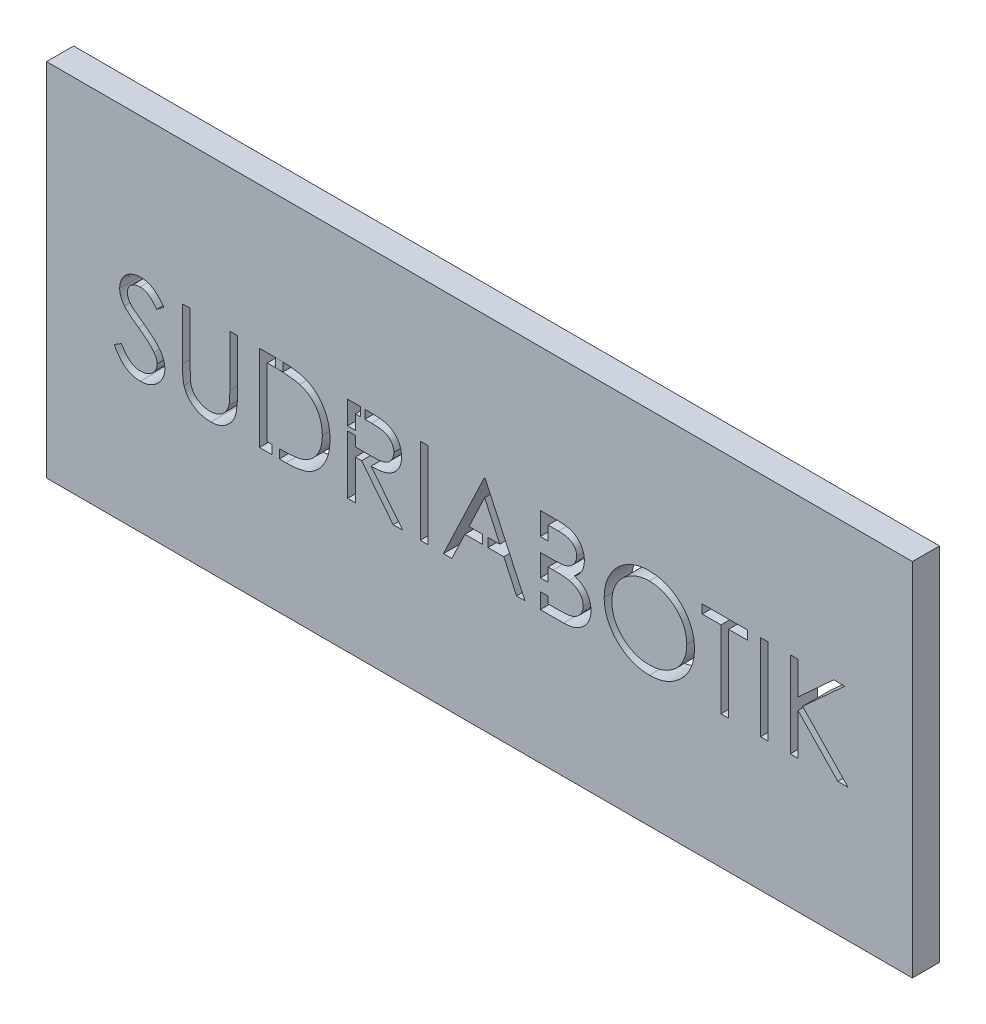
from build123d import *

# Parameters (mm, degrees)
ESQUISSE1_W             = 330
ESQUISSE1_H             = 238
ESQUISSE1_R             = 8
ESQUISSE1_W_2           = 15
ESQUISSE1_H_2           = 6
ESQUISSE1_W_3           = 20
BOSS_EXTRU_1_DEPTH      = 6
ESQUISSE2_W             = 20
ESQUISSE2_H             = 6
BOSS_EXTRU_2_DEPTH      = 6
ESQUISSE3_W             = 6
ESQUISSE3_H             = 20
ESQUISSE3_W_2           = 12
ESQUISSE3_H_2           = 10
ENL_V_MAT_EXTRU_1_DEPTH = 6
ESQUISSE4_R             = 1.5
ENL_V_MAT_EXTRU_2_DEPTH = 6
ESQUISSE5_W             = 423.604058921
ESQUISSE5_H             = 150.356061945
ENL_V_MAT_EXTRU_3_DEPTH = 6
ESQUISSE6_W             = 1.709615384
ESQUISSE6_H             = 19.05
ESQUISSE6_W_2           = 1.709615385
ENL_V_MAT_EXTRU_4_DEPTH = 6
ESQUISSE7_W             = 1.58262541
ESQUISSE7_H             = 1.953846154
ESQUISSE7_W_2           = 1.587980571
ESQUISSE7_H_2           = 1.936817114
ESQUISSE7_W_3           = 0.906225897
ESQUISSE7_W_4           = 1.709615385
ESQUISSE7_H_3           = 0.97063598
ESQUISSE7_W_5           = 1.216684544
ESQUISSE7_W_6           = 1.709615384
ESQUISSE7_H_4           = 3.052884616
ESQUISSE7_H_5           = 2.641773465
BOSS_EXTRU_5_DEPTH      = 6
ENL_V_MAT_EXTRU_5_DEPTH = 6


with BuildPart() as part:
    # Esquisse1 → Boss.-Extru.1 (new body)
    with BuildSketch(Plane.XY):
        Rectangle(ESQUISSE1_W, ESQUISSE1_H)
        with Locations((-125, 76)):
            Circle(ESQUISSE1_R, mode=Mode.SUBTRACT)
        with Locations((125, 76)):
            Circle(ESQUISSE1_R, mode=Mode.SUBTRACT)
        with Locations((-85, -58)):
            Rectangle(ESQUISSE1_W_2, ESQUISSE1_H_2, mode=Mode.SUBTRACT)
        with Locations((0, -58)):
            Rectangle(ESQUISSE1_W_2, ESQUISSE1_H_2, mode=Mode.SUBTRACT)
        with Locations((85, -58)):
            Rectangle(ESQUISSE1_W_2, ESQUISSE1_H_2, mode=Mode.SUBTRACT)
        with Locations((65, 96)):
            Rectangle(ESQUISSE1_W_3, ESQUISSE1_H_2, mode=Mode.SUBTRACT)
        with Locations((95, 96)):
            Rectangle(ESQUISSE1_W_3, ESQUISSE1_H_2, mode=Mode.SUBTRACT)
    extrude(amount=BOSS_EXTRU_1_DEPTH)

    # Esquisse2 → Boss.-Extru.2 (add)
    with BuildSketch(Plane.XY.offset(6)):
        with Locations((-105, 122)):
            Rectangle(ESQUISSE2_W, ESQUISSE2_H)
        with Locations((105, 122)):
            Rectangle(ESQUISSE2_W, ESQUISSE2_H)
        with Locations((35, 122)):
            Rectangle(ESQUISSE2_W, ESQUISSE2_H)
        with Locations((-35, 122)):
            Rectangle(ESQUISSE2_W, ESQUISSE2_H)
        with Locations((105, -122)):
            Rectangle(ESQUISSE2_W, ESQUISSE2_H)
        with Locations((-105, -122)):
            Rectangle(ESQUISSE2_W, ESQUISSE2_H)
        with Locations((-35, -122)):
            Rectangle(ESQUISSE2_W, ESQUISSE2_H)
        with Locations((35, -122)):
            Rectangle(ESQUISSE2_W, ESQUISSE2_H)
    extrude(amount=-BOSS_EXTRU_2_DEPTH)

    # Esquisse3 → Enlèv. mat.-Extru.1 (cut)
    with BuildSketch(Plane.XY.offset(6)):
        with Locations((-162, 79)):
            Rectangle(ESQUISSE3_W, ESQUISSE3_H)
        with Locations((-162, 19)):
            Rectangle(ESQUISSE3_W, ESQUISSE3_H)
        with Locations((-162, -19)):
            Rectangle(ESQUISSE3_W, ESQUISSE3_H)
        with Locations((-162, -79)):
            Rectangle(ESQUISSE3_W, ESQUISSE3_H)
        with Locations((162, -79)):
            Rectangle(ESQUISSE3_W, ESQUISSE3_H)
        with Locations((162, -19)):
            Rectangle(ESQUISSE3_W, ESQUISSE3_H)
        with Locations((162, 19)):
            Rectangle(ESQUISSE3_W, ESQUISSE3_H)
        with Locations((162, 79)):
            Rectangle(ESQUISSE3_W, ESQUISSE3_H)
        with Locations((159, -114)):
            Rectangle(ESQUISSE3_W_2, ESQUISSE3_H_2)
        with Locations((-159, -114)):
            Rectangle(ESQUISSE3_W_2, ESQUISSE3_H_2)
    extrude(amount=-ENL_V_MAT_EXTRU_1_DEPTH, mode=Mode.SUBTRACT)

    # Esquisse4 → Enlèv. mat.-Extru.2 (cut)
    with BuildSketch(Plane.XY.offset(6)):
        with Locations((-162, 114)):
            Circle(ESQUISSE4_R)
        with Locations((-162, 94)):
            Circle(ESQUISSE4_R)
        with Locations((-162, 64)):
            Circle(ESQUISSE4_R)
        with Locations((-162, 34)):
            Circle(ESQUISSE4_R)
        with Locations((-162, 4)):
            Circle(ESQUISSE4_R)
        with Locations((-105, 122)):
            Circle(ESQUISSE4_R)
        with Locations((-162, -4)):
            Circle(ESQUISSE4_R)
        with Locations((-162, -34)):
            Circle(ESQUISSE4_R)
        with Locations((-162, -64)):
            Circle(ESQUISSE4_R)
        with Locations((-162, -94)):
            Circle(ESQUISSE4_R)
        with Locations((-97.5, -58)):
            Circle(ESQUISSE4_R)
        with Locations((-72.5, -58)):
            Circle(ESQUISSE4_R)
        with Locations((162, -94)):
            Circle(ESQUISSE4_R)
        with Locations((162, -64)):
            Circle(ESQUISSE4_R)
        with Locations((162, -34)):
            Circle(ESQUISSE4_R)
        with Locations((162, -4)):
            Circle(ESQUISSE4_R)
        with Locations((80, 96)):
            Circle(ESQUISSE4_R)
        with Locations((162, 4)):
            Circle(ESQUISSE4_R)
        with Locations((162, 34)):
            Circle(ESQUISSE4_R)
        with Locations((162, 64)):
            Circle(ESQUISSE4_R)
        with Locations((162, 94)):
            Circle(ESQUISSE4_R)
        with Locations((162, 114)):
            Circle(ESQUISSE4_R)
        with Locations((-12.5, -58)):
            Circle(ESQUISSE4_R)
        with Locations((12.5, -58)):
            Circle(ESQUISSE4_R)
        with Locations((72.5, -58)):
            Circle(ESQUISSE4_R)
        with Locations((97.5, -58)):
            Circle(ESQUISSE4_R)
        with Locations((-35, 122)):
            Circle(ESQUISSE4_R)
        with Locations((35, 122)):
            Circle(ESQUISSE4_R)
        with Locations((105, 122)):
            Circle(ESQUISSE4_R)
    extrude(amount=-ENL_V_MAT_EXTRU_2_DEPTH, mode=Mode.SUBTRACT)

    # Esquisse5 → Enlèv. mat.-Extru.3 (cut)
    with BuildSketch(Plane.XY.offset(6)):
        with Locations((11.705214191, -75.178030973)):
            Rectangle(ESQUISSE5_W, ESQUISSE5_H)
    extrude(amount=-ENL_V_MAT_EXTRU_3_DEPTH, mode=Mode.SUBTRACT)

    # Esquisse6 → Enlèv. mat.-Extru.4 (cut)
    # profile 1 of 11: a face of its own
    with BuildSketch(Plane.XY.offset(6)):
        with BuildLine():
            Line((-81.011538462, 33.174909856), (-79.401141827, 34.140384615))
            add(Edge.make_bspline(
                [(-79.401141827, 34.140384615), (-79.251363993, 33.889662749), (-78.964395442, 33.409289328), (-78.485688759, 32.760184851), (-77.989665343, 32.208485112), (-77.47265197, 31.757399576), (-76.937804452, 31.402259207), (-76.381631246, 31.15078706), (-75.80600659, 30.993945823), (-75.414263362, 30.974895352), (-75.218689904, 30.965384615)],
                knots=[0, 0, 0, 0, 1.272034388, 2.437168799, 3.508375237, 4.49857839, 5.41946034, 6.295179144, 7.148887113, 8, 8, 8, 8], degree=3))
            add(Edge.make_bspline(
                [(-75.218689904, 30.965384615), (-75.051665706, 30.970036476), (-74.720539841, 30.9792588), (-74.233065347, 31.06787288), (-73.759635824, 31.204010324), (-73.31000881, 31.398978537), (-72.890388393, 31.634863724), (-72.522414809, 31.91977649), (-72.204300964, 32.238761695), (-71.944082784, 32.594630144), (-71.744438591, 32.977356339), (-71.59099319, 33.370199731), (-71.50583929, 33.77933151), (-71.493011817, 34.054797029), (-71.486538462, 34.193810096)],
                knots=[0, 0, 0, 0, 1.095163259, 2.171163733, 3.241058638, 4.321873601, 5.38011039, 6.391990106, 7.366004449, 8.327778327, 9.272591725, 10.192022065, 11.087607919, 12, 12, 12, 12], degree=3))
            add(Edge.make_bspline(
                [(-71.486538462, 34.193810096), (-71.494562924, 34.352419578), (-71.510875484, 34.674849478), (-71.648751111, 35.150553303), (-71.865644869, 35.621320006), (-72.065738687, 35.912519751), (-72.169621394, 36.063701923)],
                knots=[0, 0, 0, 0, 0.938893495, 1.908633276, 2.914225137, 4, 4, 4, 4], degree=3))
            add(Edge.make_bspline(
                [(-72.169621394, 36.063701923), (-72.254914309, 36.17281392), (-72.433976113, 36.401880909), (-72.741810575, 36.742849977), (-73.103031854, 37.0945588), (-73.505278346, 37.470437381), (-73.963202729, 37.853003818), (-74.462462486, 38.260501159), (-75.015804347, 38.6774326), (-75.403877322, 38.957046135), (-75.604116587, 39.101322115)],
                knots=[0, 0, 0, 0, 0.722233717, 1.516239348, 2.393582979, 3.351407094, 4.387010283, 5.505090956, 6.712668013, 8, 8, 8, 8], degree=3))
            add(Edge.make_bspline(
                [(-75.604116587, 39.101322115), (-75.804544337, 39.244080571), (-76.187746934, 39.517023867), (-76.723642932, 39.922104613), (-77.202856367, 40.292457674), (-77.623257299, 40.631569511), (-77.984660819, 40.939486117), (-78.289914814, 41.213250614), (-78.531243246, 41.460266853), (-78.665440049, 41.62051187), (-78.725691106, 41.692457933)],
                knots=[0, 0, 0, 0, 1.452282411, 2.77665338, 3.964542531, 5.026858415, 5.96415736, 6.766646006, 7.446254459, 8, 8, 8, 8], degree=3))
            add(Edge.make_bspline(
                [(-78.725691106, 41.692457933), (-78.809905959, 41.804586433), (-78.97552577, 42.025102178), (-79.1941436, 42.369770333), (-79.379958186, 42.722594106), (-79.525621737, 43.084521597), (-79.648283157, 43.45047171), (-79.730785608, 43.825219204), (-79.782445925, 44.207082542), (-79.787736309, 44.464058881), (-79.790384615, 44.592698317)],
                knots=[0, 0, 0, 0, 1.068054152, 2.10047183, 3.106115577, 4.101338837, 5.06977816, 6.043150881, 7.020423561, 8, 8, 8, 8], degree=3))
            add(Edge.make_bspline(
                [(-79.790384615, 44.592698317), (-79.783280549, 44.79424609), (-79.769224262, 45.193033694), (-79.650349446, 45.775587214), (-79.462718411, 46.331773285), (-79.199856235, 46.85608553), (-78.860998357, 47.334871798), (-78.468862411, 47.773639491), (-78.00180275, 48.142494203), (-77.489343472, 48.464776978), (-76.928422361, 48.717031228), (-76.340643301, 48.907318848), (-75.725072095, 49.015137808), (-75.308132177, 49.030610571), (-75.096574519, 49.038461538)],
                knots=[0, 0, 0, 0, 1.005424448, 1.989358655, 2.955360095, 3.929531133, 4.905563448, 5.876582895, 6.856512386, 7.866279853, 8.892233794, 9.918561126, 10.94386622, 12, 12, 12, 12], degree=3))
            add(Edge.make_bspline(
                [(-75.096574519, 49.038461538), (-74.872088773, 49.030718793), (-74.425658273, 49.015320944), (-73.768981828, 48.881440095), (-73.136735643, 48.659912153), (-72.628137302, 48.408513886), (-72.230086129, 48.157427181), (-71.926523112, 47.92871928), (-71.618906702, 47.665420475), (-71.304755575, 47.366829435), (-70.989392843, 47.030206404), (-70.668136624, 46.657856798), (-70.340235675, 46.252056115), (-70.129293065, 45.962362761), (-70.021153846, 45.813852163)],
                knots=[0, 0, 0, 0, 1.286793592, 2.559021753, 3.825965368, 5.121522368, 5.803751409, 6.523245864, 7.299691795, 8.125521123, 9.008227632, 9.944561021, 10.946284179, 12, 12, 12, 12], degree=3))
            Line((-70.021153846, 45.813852163), (-71.566676683, 44.642307692))
            add(Edge.make_bspline(
                [(-71.566676683, 44.642307692), (-71.659999544, 44.762533279), (-71.839717554, 44.994059648), (-72.11256519, 45.318297809), (-72.369732831, 45.614478933), (-72.623100007, 45.871736273), (-72.859285344, 46.104157885), (-73.088522388, 46.303147418), (-73.307512214, 46.470654588), (-73.583557113, 46.649417392), (-73.930363552, 46.82661779), (-74.365707956, 46.976563487), (-74.82065611, 47.066670324), (-75.130515962, 47.078584126), (-75.287379808, 47.084615385)],
                knots=[0, 0, 0, 0, 1.181633172, 2.275549214, 3.290209073, 4.226197932, 5.078386478, 5.862611352, 6.581680152, 7.217281963, 8.414376989, 9.595101626, 10.782541182, 12, 12, 12, 12], degree=3))
            add(Edge.make_bspline(
                [(-75.287379808, 47.084615385), (-75.484174594, 47.078020275), (-75.863674801, 47.065302227), (-76.402464514, 46.926400593), (-76.887390021, 46.707696467), (-77.304054696, 46.401182087), (-77.650965957, 46.038029255), (-77.901911383, 45.620132915), (-78.052951564, 45.15867441), (-78.0713826, 44.836774823), (-78.080769231, 44.672836538)],
                knots=[0, 0, 0, 0, 1.14458467, 2.207223713, 3.21896685, 4.227309161, 5.202851033, 6.127160689, 7.046193047, 8, 8, 8, 8], degree=3))
            add(Edge.make_bspline(
                [(-78.080769231, 44.672836538), (-78.078629499, 44.57077492), (-78.074346536, 44.366484791), (-78.01461228, 44.064670623), (-77.937871646, 43.763618904), (-77.816263893, 43.464683132), (-77.648377312, 43.162635263), (-77.427913426, 42.852274092), (-77.150255256, 42.530864077), (-76.937564661, 42.321818229), (-76.825270433, 42.211448317)],
                knots=[0, 0, 0, 0, 0.858281714, 1.717966888, 2.583508476, 3.4729293, 4.427298488, 5.488583878, 6.674047936, 8, 8, 8, 8], degree=3))
            add(Edge.make_bspline(
                [(-76.825270433, 42.211448317), (-76.783570677, 42.174235363), (-76.684501603, 42.0858259), (-76.503385493, 41.941087915), (-76.26421112, 41.762547112), (-75.973223996, 41.541636147), (-75.625058785, 41.285378474), (-75.2196772, 40.997050671), (-74.761598, 40.667292672), (-74.436540144, 40.43674663), (-74.264663462, 40.31484375)],
                knots=[0, 0, 0, 0, 0.420754252, 0.999615792, 1.744751191, 2.668019286, 3.750313428, 4.999500688, 6.413464383, 8, 8, 8, 8], degree=3))
            add(Edge.make_bspline(
                [(-74.264663462, 40.31484375), (-74.057911562, 40.164395779), (-73.657565164, 39.873074134), (-73.087928907, 39.435383076), (-72.571435466, 39.007314507), (-72.106271458, 38.591602102), (-71.687841428, 38.191399196), (-71.320787548, 37.801891029), (-71.001369774, 37.425868126), (-70.657494313, 36.94378025), (-70.306115324, 36.351700348), (-70.004355119, 35.626285936), (-69.814081828, 34.898051677), (-69.789199723, 34.408592753), (-69.776923077, 34.167097356)],
                knots=[0, 0, 0, 0, 1.163667725, 2.253281268, 3.268753668, 4.215851969, 5.092017293, 5.902905408, 6.650798638, 7.335211899, 8.59617414, 9.77448103, 10.901945474, 12, 12, 12, 12], degree=3))
            add(Edge.make_bspline(
                [(-69.776923077, 34.167097356), (-69.780499786, 33.996309397), (-69.787583746, 33.658050067), (-69.869013863, 33.16136172), (-69.988319469, 32.678956558), (-70.168136414, 32.216797503), (-70.387609604, 31.76642958), (-70.666100181, 31.339666579), (-70.988903437, 30.927063181), (-71.3592015, 30.539621607), (-71.764399911, 30.183951597), (-72.192664021, 29.86756342), (-72.644694792, 29.60375726), (-73.11804003, 29.388487677), (-73.612808463, 29.22012096), (-74.128833686, 29.098130915), (-74.666966312, 29.023260545), (-75.032728933, 29.015489444), (-75.218689904, 29.011538462)],
                knots=[0, 0, 0, 0, 0.983748083, 1.948392443, 2.894712957, 3.844097841, 4.80183111, 5.778335162, 6.776009319, 7.81870978, 8.863265674, 9.881300176, 10.883814829, 11.87499822, 12.874611388, 13.892143829, 14.928324115, 16, 16, 16, 16], degree=3))
            add(Edge.make_bspline(
                [(-75.218689904, 29.011538462), (-75.362573699, 29.01432075), (-75.648529222, 29.019850287), (-76.07149083, 29.068734113), (-76.485907737, 29.137897063), (-76.886579758, 29.247701643), (-77.278669098, 29.380926333), (-77.660470475, 29.544964972), (-78.032168925, 29.741545739), (-78.395847483, 29.966308659), (-78.750581205, 30.227880098), (-79.093042881, 30.532535842), (-79.434468876, 30.87187352), (-79.764781705, 31.255108157), (-80.090662676, 31.676048294), (-80.40568659, 32.138632278), (-80.716374225, 32.640340446), (-80.9113127, 32.993391841), (-81.011538462, 33.174909856)],
                knots=[0, 0, 0, 0, 0.915332311, 1.819136955, 2.706846663, 3.586547465, 4.459518054, 5.340707479, 6.227863349, 7.133153174, 8.059268498, 9.028702269, 10.047606654, 11.120612155, 12.245963614, 13.433783089, 14.680604001, 16, 16, 16, 16], degree=3))
        make_face()
    # profile 2 of 11: a face of its own
    with BuildSketch(Plane.XY.offset(6)):
        with BuildLine():
            Line((-65.869230769, 48.55), (-64.159615385, 48.55))
            Line((-64.159615385, 48.55), (-64.159615385, 37.136027644))
            add(Edge.make_bspline(
                [(-64.159615385, 37.136027644), (-64.159869805, 36.97447964), (-64.160352613, 36.667914462), (-64.157127644, 36.231569854), (-64.148095939, 35.843644041), (-64.142401842, 35.502641707), (-64.129734498, 35.21012761), (-64.1194037, 34.96451699), (-64.106120098, 34.766972831), (-64.090155559, 34.651688077), (-64.083293269, 34.602133413)],
                knots=[0, 0, 0, 0, 1.528628734, 2.90083645, 4.128790002, 5.200304208, 6.127813768, 6.898992206, 7.526736466, 8, 8, 8, 8], degree=3))
            add(Edge.make_bspline(
                [(-64.083293269, 34.602133413), (-64.055113101, 34.423353173), (-64.000340615, 34.075866319), (-63.860751044, 33.581065527), (-63.665801503, 33.135124305), (-63.434790085, 32.724127134), (-63.130356872, 32.359513618), (-62.765666201, 32.023625907), (-62.323827204, 31.729865085), (-61.832551622, 31.461255666), (-61.303041972, 31.245364289), (-60.761960651, 31.082114692), (-60.217441007, 30.982625252), (-59.852899308, 30.971105233), (-59.671875, 30.965384615)],
                knots=[0, 0, 0, 0, 1.035780045, 2.013197591, 2.933192213, 3.817615948, 4.702609284, 5.640816605, 6.646850145, 7.73207398, 8.84249596, 9.914020372, 10.964143139, 12, 12, 12, 12], degree=3))
            add(Edge.make_bspline(
                [(-59.671875, 30.965384615), (-59.51646107, 30.971229429), (-59.20653084, 30.982885298), (-58.746030125, 31.055065373), (-58.297538105, 31.185152738), (-57.858840118, 31.353009137), (-57.447626903, 31.574792454), (-57.063669026, 31.830992309), (-56.720965327, 32.13149722), (-56.408229653, 32.464057667), (-56.135896645, 32.839287149), (-55.899833717, 33.249015301), (-55.706471157, 33.699408174), (-55.610984258, 34.015934387), (-55.561929087, 34.178545673)],
                knots=[0, 0, 0, 0, 0.994687771, 1.983630487, 2.973142513, 3.978332533, 4.983357753, 5.956394766, 6.925816176, 7.893390482, 8.871859704, 9.88551698, 10.913711441, 12, 12, 12, 12], degree=3))
            add(Edge.make_bspline(
                [(-55.561929087, 34.178545673), (-55.545599833, 34.245757199), (-55.509211676, 34.395531565), (-55.475209903, 34.648740304), (-55.439795814, 34.947495271), (-55.415223655, 35.293942995), (-55.391268441, 35.686922574), (-55.376937002, 36.128481204), (-55.370312865, 36.617015519), (-55.368338848, 36.957940643), (-55.367307692, 37.136027644)],
                knots=[0, 0, 0, 0, 0.558680831, 1.244966039, 2.062412453, 2.990489873, 4.051219941, 5.244515665, 6.560634259, 8, 8, 8, 8], degree=3))
            Line((-55.367307692, 37.136027644), (-55.367307692, 48.55))
            Line((-55.367307692, 48.55), (-53.657692308, 48.55))
            Line((-53.657692308, 48.55), (-53.657692308, 37.044441106))
            add(Edge.make_bspline(
                [(-53.657692308, 37.044441106), (-53.659075449, 36.837077072), (-53.661774732, 36.432393552), (-53.685182156, 35.839386869), (-53.722503826, 35.276851356), (-53.775234705, 34.744711397), (-53.84510468, 34.244871187), (-53.922802666, 33.77294952), (-54.021751267, 33.332333946), (-54.137321636, 32.91958893), (-54.269439091, 32.526693493), (-54.440568769, 32.15381089), (-54.633379262, 31.789605372), (-54.862059016, 31.439585522), (-55.119023827, 31.102201569), (-55.409953689, 30.779499603), (-55.725226622, 30.466322794), (-56.070083654, 30.170704534), (-56.438840084, 29.899603022), (-56.830398996, 29.66121801), (-57.241752557, 29.45970375), (-57.671831487, 29.293827647), (-58.12081932, 29.169106757), (-58.588727377, 29.076169123), (-59.076620701, 29.023360904), (-59.408442616, 29.015512684), (-59.576472356, 29.011538462)],
                knots=[0, 0, 0, 0, 1.316592851, 2.569410997, 3.76748051, 4.895814652, 5.963796859, 6.97159953, 7.931736103, 8.829262218, 9.692595152, 10.560224239, 11.431080259, 12.30701507, 13.211635791, 14.121146779, 15.063487852, 16.031507147, 17.00238618, 17.966455255, 18.938106653, 19.907068911, 20.888905087, 21.893141452, 22.933117798, 24, 24, 24, 24], degree=3))
            add(Edge.make_bspline(
                [(-59.576472356, 29.011538462), (-59.759728471, 29.015809827), (-60.119276315, 29.02419023), (-60.649073509, 29.072211199), (-61.156969349, 29.162662745), (-61.648328051, 29.277833296), (-62.116460014, 29.436676209), (-62.56763719, 29.622267431), (-62.994132297, 29.850199376), (-63.402864355, 30.103800558), (-63.782910527, 30.389140375), (-64.131783536, 30.700146179), (-64.450059346, 31.031835947), (-64.73237325, 31.387800795), (-64.983402636, 31.765272229), (-65.199648512, 32.165318091), (-65.385322026, 32.587783498), (-65.481152056, 32.88144306), (-65.529597356, 33.029897837)],
                knots=[0, 0, 0, 0, 1.13879206, 2.234305948, 3.301075583, 4.341971843, 5.366689343, 6.369221514, 7.369726634, 8.367512178, 9.355451585, 10.318319045, 11.268648973, 12.207971039, 13.137398894, 14.081662264, 15.030215811, 16, 16, 16, 16], degree=3))
            add(Edge.make_bspline(
                [(-65.529597356, 33.029897837), (-65.557775888, 33.131312277), (-65.618895752, 33.351282458), (-65.68434773, 33.71533606), (-65.739370017, 34.134517255), (-65.791107412, 34.608854735), (-65.821636169, 35.138716152), (-65.848401085, 35.723871822), (-65.869419325, 36.3650293), (-65.869295378, 36.811640306), (-65.869230769, 37.044441106)],
                knots=[0, 0, 0, 0, 0.625038921, 1.35572334, 2.194682327, 3.136881307, 4.189498639, 5.346923369, 6.617055217, 8, 8, 8, 8], degree=3))
            Line((-65.869230769, 37.044441106), (-65.869230769, 48.55))
        make_face()
    # profile 3 of 11: a face of its own
    with BuildSketch(Plane.XY.offset(6)):
        with BuildLine():
            Line((-48.773076923, 29.5), (-48.773076923, 48.55))
            Line((-48.773076923, 48.55), (-44.926442308, 48.55))
            add(Edge.make_bspline(
                [(-44.926442308, 48.55), (-44.591875386, 48.547591155), (-43.945493835, 48.542937278), (-43.0114318, 48.513429421), (-42.147194464, 48.461229885), (-41.355624188, 48.38519575), (-40.634547877, 48.291834239), (-39.985984596, 48.174810609), (-39.406580789, 48.036626425), (-39.050239977, 47.918813331), (-38.881730769, 47.863100962)],
                knots=[0, 0, 0, 0, 1.314313732, 2.53924729, 3.670748893, 4.714932338, 5.66265055, 6.526160246, 7.303039223, 8, 8, 8, 8], degree=3))
            add(Edge.make_bspline(
                [(-38.881730769, 47.863100962), (-38.661323688, 47.779113835), (-38.225507627, 47.613044132), (-37.604983146, 47.299773406), (-37.020826527, 46.944827809), (-36.469905182, 46.547739471), (-35.964803541, 46.097264945), (-35.485789132, 45.612539951), (-35.052457563, 45.075937699), (-34.655628124, 44.498586693), (-34.29783832, 43.887288237), (-33.986838047, 43.243207146), (-33.72855274, 42.569614342), (-33.514141035, 41.868383036), (-33.345159602, 41.137971323), (-33.229869374, 40.377528709), (-33.153827272, 39.59006055), (-33.146185221, 39.055710968), (-33.142307692, 38.784585337)],
                knots=[0, 0, 0, 0, 0.984719456, 1.947108742, 2.898477687, 3.838006223, 4.779231079, 5.722358779, 6.681677486, 7.655904652, 8.64651281, 9.637519902, 10.640069247, 11.656948941, 12.698408672, 13.768548281, 14.867775369, 16, 16, 16, 16], degree=3))
            add(Edge.make_bspline(
                [(-33.142307692, 38.784585337), (-33.145731072, 38.549120596), (-33.152477201, 38.08511273), (-33.213052477, 37.401267284), (-33.301097876, 36.737709131), (-33.437409867, 36.097598107), (-33.602886405, 35.47532595), (-33.814962714, 34.877524734), (-34.057907343, 34.298710572), (-34.341207396, 33.746709738), (-34.652219792, 33.223741669), (-34.98598528, 32.730752009), (-35.342147865, 32.274775444), (-35.72410381, 31.854431142), (-36.126917238, 31.470352779), (-36.55322538, 31.119331953), (-37.00412827, 30.80823699), (-37.477606347, 30.524843158), (-37.987472136, 30.277626652), (-38.543383065, 30.068457598), (-39.147709905, 29.895121021), (-39.798969299, 29.750499431), (-40.498286514, 29.635778683), (-41.246347171, 29.558890747), (-42.042001933, 29.506895499), (-42.588351934, 29.50234313), (-42.869561298, 29.5)],
                knots=[0, 0, 0, 0, 1.105936401, 2.179363191, 3.223086493, 4.248585256, 5.251745608, 6.245858792, 7.225916811, 8.198733463, 9.158002045, 10.082870192, 10.993790845, 11.873723703, 12.748670949, 13.606408763, 14.465103618, 15.319838547, 16.196477973, 17.123216899, 18.106603292, 19.147568657, 20.255746949, 21.433717677, 22.679120308, 24, 24, 24, 24], degree=3))
            Line((-42.869561298, 29.5), (-48.773076923, 29.5))
        make_face()
        with BuildLine():
            Line((-47.063461538, 31.453846154), (-44.876832933, 31.453846154))
            add(Edge.make_bspline(
                [(-44.876832933, 31.453846154), (-44.562625658, 31.455196507), (-43.958289998, 31.457793731), (-43.089294327, 31.480584079), (-42.295293612, 31.517823767), (-41.576175111, 31.569939548), (-40.93234485, 31.638893011), (-40.362457297, 31.715772839), (-39.868380534, 31.811553249), (-39.569407455, 31.898372042), (-39.43125, 31.938491587)],
                knots=[0, 0, 0, 0, 1.375205317, 2.645023457, 3.804390687, 4.853969522, 5.800190428, 6.637939096, 7.370582563, 8, 8, 8, 8], degree=3))
            add(Edge.make_bspline(
                [(-39.43125, 31.938491587), (-39.257359629, 31.999732211), (-38.913732256, 32.120750728), (-38.419079492, 32.341500284), (-37.957759224, 32.602986406), (-37.5217318, 32.893647355), (-37.117182433, 33.22373488), (-36.739316886, 33.586071262), (-36.388895938, 33.982500538), (-36.069540062, 34.412530674), (-35.783744864, 34.873485133), (-35.536251458, 35.360832214), (-35.319345265, 35.869232138), (-35.149100354, 36.406491987), (-35.015665531, 36.967808719), (-34.921152016, 37.553221823), (-34.862289015, 38.162621971), (-34.855423134, 38.577107105), (-34.851923077, 38.788401442)],
                knots=[0, 0, 0, 0, 0.998632004, 1.973411704, 2.929992603, 3.868527914, 4.809262121, 5.754881198, 6.702106254, 7.672490631, 8.653608572, 9.636854334, 10.631411391, 11.644891563, 12.686317036, 13.754757253, 14.855430412, 16, 16, 16, 16], degree=3))
            add(Edge.make_bspline(
                [(-34.851923077, 38.788401442), (-34.854716827, 39.011196528), (-34.860205173, 39.448879446), (-34.929189634, 40.091085944), (-35.029999815, 40.708744914), (-35.175779591, 41.301897663), (-35.361549089, 41.871701408), (-35.593385639, 42.415004742), (-35.858271096, 42.937545529), (-36.173430686, 43.427263148), (-36.518592701, 43.890412785), (-36.901649445, 44.314710254), (-37.316515112, 44.701122088), (-37.758664792, 45.055666061), (-38.240559575, 45.364078354), (-38.750847521, 45.639958718), (-39.297014674, 45.87408807), (-39.676995204, 45.998614451), (-39.870102163, 46.061899038)],
                knots=[0, 0, 0, 0, 1.122418816, 2.205001699, 3.251619955, 4.274784885, 5.280384055, 6.268708349, 7.249350384, 8.229342522, 9.199999885, 10.157847722, 11.105861043, 12.055065948, 13.010012805, 13.98527497, 14.976112212, 16, 16, 16, 16], degree=3))
            add(Edge.make_bspline(
                [(-39.870102163, 46.061899038), (-40.02985626, 46.106075596), (-40.369537302, 46.200007078), (-40.923834956, 46.302470891), (-41.54766884, 46.392846807), (-42.243808642, 46.469362707), (-43.011460827, 46.524266556), (-43.851215786, 46.56547614), (-44.763436491, 46.593270811), (-45.395801425, 46.595168774), (-45.724008413, 46.596153846)],
                knots=[0, 0, 0, 0, 0.674548936, 1.434276114, 2.292660221, 3.240891867, 4.284742987, 5.42552168, 6.663806718, 8, 8, 8, 8], degree=3))
            Line((-45.724008413, 46.596153846), (-47.063461538, 46.596153846))
            Line((-47.063461538, 46.596153846), (-47.063461538, 31.453846154))
        make_face(mode=Mode.SUBTRACT)
    # profile 4 of 11: a face of its own
    with BuildSketch(Plane.XY.offset(6)):
        with BuildLine():
            Line((-29.234615385, 48.55), (-25.422325721, 48.55))
            add(Edge.make_bspline(
                [(-25.422325721, 48.55), (-25.167920436, 48.549153168), (-24.679434107, 48.547527156), (-23.979628164, 48.538460646), (-23.343754965, 48.51247451), (-22.772146982, 48.490112077), (-22.264814703, 48.449334511), (-21.820202449, 48.410360132), (-21.440357981, 48.359340635), (-21.210419848, 48.311958262), (-21.106310096, 48.290504808)],
                knots=[0, 0, 0, 0, 1.410062039, 2.707475311, 3.878576406, 4.937260626, 5.877586885, 6.699081471, 7.410979367, 8, 8, 8, 8], degree=3))
            add(Edge.make_bspline(
                [(-21.106310096, 48.290504808), (-20.966936899, 48.256069128), (-20.691163714, 48.187932374), (-20.294106925, 48.043916547), (-19.915750391, 47.877258304), (-19.557665776, 47.681512912), (-19.221646684, 47.455227326), (-18.904228449, 47.202307973), (-18.603970713, 46.924138753), (-18.333016411, 46.613706259), (-18.077533858, 46.288024685), (-17.86205862, 45.93585138), (-17.676313066, 45.567579351), (-17.528427824, 45.179463263), (-17.409349139, 44.775267048), (-17.325386322, 44.351329454), (-17.27503343, 43.909581861), (-17.269907044, 43.608276672), (-17.267307692, 43.455498798)],
                knots=[0, 0, 0, 0, 1.027469482, 2.033020251, 3.019912614, 3.986113645, 4.951240523, 5.91722682, 6.890402269, 7.87763091, 8.8651537, 9.85103654, 10.82876324, 11.815024772, 12.821070561, 13.842952187, 14.906261191, 16, 16, 16, 16], degree=3))
            add(Edge.make_bspline(
                [(-17.267307692, 43.455498798), (-17.275303239, 43.201670586), (-17.290904622, 42.706386001), (-17.436365543, 41.987597489), (-17.674634887, 41.317095648), (-18.002965931, 40.695724719), (-18.421083363, 40.135596777), (-18.923594012, 39.643614442), (-19.510778211, 39.231917204), (-20.057400631, 38.946424081), (-20.540259347, 38.763582678), (-20.937769235, 38.634933354), (-21.371385212, 38.535536085), (-21.836952705, 38.446490225), (-22.336409173, 38.379261717), (-22.86855753, 38.330022396), (-23.433777298, 38.299248217), (-23.822065661, 38.294665304), (-24.021814904, 38.292307692)],
                knots=[0, 0, 0, 0, 1.260483769, 2.459530307, 3.627416485, 4.787058657, 5.939039949, 7.08810263, 8.267026773, 9.491475466, 10.141966685, 10.831826277, 11.566392101, 12.351337768, 13.187381173, 14.07005841, 15.007169909, 16, 16, 16, 16], degree=3))
            Line((-24.021814904, 38.292307692), (-17.023076923, 29.5))
            Line((-17.023076923, 29.5), (-19.137199519, 29.5))
            Line((-19.137199519, 29.5), (-26.1359375, 38.292307692))
            Line((-26.1359375, 38.292307692), (-27.525, 38.292307692))
            Line((-27.525, 38.292307692), (-27.525, 29.5))
            Line((-27.525, 29.5), (-29.234615385, 29.5))
            Line((-29.234615385, 29.5), (-29.234615385, 48.55))
        make_face()
        with BuildLine():
            Line((-27.525, 46.596153846), (-27.525, 40.246153846))
            Line((-27.525, 40.246153846), (-24.037079327, 40.219441106))
            add(Edge.make_bspline(
                [(-24.037079327, 40.219441106), (-23.874228829, 40.219369061), (-23.558578183, 40.219229416), (-23.10191885, 40.24096697), (-22.676722242, 40.265695602), (-22.28461472, 40.303519897), (-21.925421117, 40.352266516), (-21.599320968, 40.413242759), (-21.305781957, 40.484283271), (-20.963434197, 40.594237835), (-20.581146791, 40.76844202), (-20.165685559, 41.021891377), (-19.811887121, 41.340674726), (-19.512977042, 41.705201679), (-19.272786851, 42.105993262), (-19.103448384, 42.538245214), (-18.99599309, 42.991045198), (-18.98331915, 43.302257471), (-18.976923077, 43.459314904)],
                knots=[0, 0, 0, 0, 1.146690395, 2.22261258, 3.21895312, 4.145990853, 4.996080663, 5.770904154, 6.481378293, 7.121626537, 8.300444488, 9.431385265, 10.535395872, 11.636531494, 12.74115979, 13.810798291, 14.895190096, 16, 16, 16, 16], degree=3))
            add(Edge.make_bspline(
                [(-18.976923077, 43.459314904), (-18.98346605, 43.612512684), (-18.996431836, 43.916094783), (-19.102288705, 44.360536237), (-19.281300909, 44.780000637), (-19.522540518, 45.17278162), (-19.816450204, 45.529319982), (-20.161080014, 45.83437663), (-20.547006861, 46.086105859), (-20.907711527, 46.24696613), (-21.230114883, 46.345589903), (-21.510039176, 46.414992666), (-21.826331647, 46.470751846), (-22.180528072, 46.515427149), (-22.571116377, 46.553826203), (-23.000071492, 46.579689455), (-23.464547396, 46.595004916), (-23.786475693, 46.595761957), (-23.953125, 46.596153846)],
                knots=[0, 0, 0, 0, 1.101028733, 2.181837193, 3.264309656, 4.369019818, 5.486613113, 6.575447106, 7.666700264, 8.788928104, 9.402425223, 10.0903467, 10.862060571, 11.710948788, 12.657782767, 13.684531032, 14.801375019, 16, 16, 16, 16], degree=3))
            Line((-23.953125, 46.596153846), (-27.525, 46.596153846))
        make_face(mode=Mode.SUBTRACT)
    # profile 5 of 11: a face of its own
    with BuildSketch(Plane.XY.offset(6)):
        with Locations((-12.260576923, 39.025)):
            Rectangle(ESQUISSE6_W, ESQUISSE6_H)
    # profile 6 of 11: a face of its own
    with BuildSketch(Plane.XY.offset(6)):
        Polygon((1.294230769, 48.55), (10.086538462, 29.5), (8.228094952, 29.5), (5.411808894, 35.605769231), (-3.224038462, 35.605769231), (-6.12046274, 29.5), (-7.986538462, 29.5), (1.05, 48.55), align=None)
        Polygon((1.153034856, 44.836929087), (-2.29672476, 37.559615385), (4.511207933, 37.559615385), align=None, mode=Mode.SUBTRACT)
    # profile 7 of 11: a face of its own
    with BuildSketch(Plane.XY.offset(6)):
        with BuildLine():
            Line((13.505769231, 48.55), (17.22265625, 48.55))
            add(Edge.make_bspline(
                [(17.22265625, 48.55), (17.404602681, 48.549043416), (17.757260148, 48.547189317), (18.270083109, 48.518433989), (18.750408779, 48.479225443), (19.198376454, 48.417013082), (19.613779134, 48.341946409), (19.997868703, 48.25104081), (20.349423783, 48.142038813), (20.769137391, 47.968704053), (21.247676988, 47.711130809), (21.76582824, 47.330519618), (22.208899886, 46.86497864), (22.590913984, 46.33983733), (22.894631506, 45.762155487), (23.114355825, 45.145701902), (23.253463689, 44.49842785), (23.267769881, 44.054055696), (23.275, 43.829477163)],
                knots=[0, 0, 0, 0, 1.001505555, 1.941167018, 2.826882275, 3.653841531, 4.429895133, 5.150066043, 5.825578002, 6.45369114, 7.647487171, 8.808567382, 9.977351308, 11.170798116, 12.373658725, 13.556498008, 14.765093433, 16, 16, 16, 16], degree=3))
            add(Edge.make_bspline(
                [(23.275, 43.829477163), (23.269049768, 43.619096825), (23.257357002, 43.205679619), (23.145545697, 42.601010253), (22.970499773, 42.025421476), (22.727175489, 41.481013921), (22.410934623, 40.980088113), (22.036148632, 40.518603136), (21.583973464, 40.116098097), (21.245192401, 39.891074585), (21.073106971, 39.776772837)],
                knots=[0, 0, 0, 0, 1.044552857, 2.05264487, 3.044412934, 4.028983338, 5.005914585, 5.980388656, 6.974128949, 8, 8, 8, 8], degree=3))
            add(Edge.make_bspline(
                [(21.073106971, 39.776772837), (21.289517298, 39.693687628), (21.703563864, 39.534725042), (22.273354874, 39.253680588), (22.76427253, 38.947998245), (23.180091282, 38.614177746), (23.535714804, 38.254356933), (23.846245814, 37.863259811), (24.111211579, 37.435784572), (24.338249063, 36.976388187), (24.515407293, 36.489761552), (24.648081858, 35.980469185), (24.724104688, 35.45033732), (24.734923136, 35.089555469), (24.740384615, 34.907421875)],
                knots=[0, 0, 0, 0, 1.27268992, 2.434971085, 3.483601985, 4.442670788, 5.356604649, 6.2567628, 7.179492994, 8.113709626, 9.066344395, 10.018646069, 10.999752585, 12, 12, 12, 12], degree=3))
            add(Edge.make_bspline(
                [(24.740384615, 34.907421875), (24.735067782, 34.721456471), (24.724606763, 34.355564329), (24.647427203, 33.818054239), (24.516749063, 33.304384887), (24.336747538, 32.811233821), (24.101821226, 32.339555089), (23.81591902, 31.888814324), (23.475024366, 31.463540324), (23.09368218, 31.059007461), (22.662269645, 30.695273362), (22.196819607, 30.371337873), (21.691470352, 30.104931449), (21.154521642, 29.881142817), (20.57995015, 29.710197923), (19.970335958, 29.590604342), (19.32620483, 29.510022641), (18.884191756, 29.503397568), (18.657512019, 29.5)],
                knots=[0, 0, 0, 0, 0.978564426, 1.925352924, 2.850884081, 3.763762016, 4.682927383, 5.618979971, 6.567305752, 7.547517671, 8.540179244, 9.531824382, 10.526200242, 11.540722885, 12.589160233, 13.674978461, 14.80764778, 16, 16, 16, 16], degree=3))
            Line((18.657512019, 29.5), (13.505769231, 29.5))
            Line((13.505769231, 29.5), (13.505769231, 48.55))
        make_face()
        with BuildLine():
            Line((15.215384615, 46.596153846), (15.215384615, 40.490384615))
            Line((15.215384615, 40.490384615), (16.364032452, 40.490384615))
            add(Edge.make_bspline(
                [(16.364032452, 40.490384615), (16.531938038, 40.492561339), (16.856365848, 40.496767213), (17.326192713, 40.50881507), (17.762301741, 40.542550135), (18.163940147, 40.576275504), (18.530475449, 40.631110046), (18.861095609, 40.696381458), (19.160989401, 40.765412698), (19.50682607, 40.882812334), (19.899108833, 41.056317966), (20.317300443, 41.325586103), (20.685969484, 41.646302939), (20.997285606, 42.016368031), (21.252073753, 42.423853986), (21.429041259, 42.862259149), (21.549041478, 43.320657296), (21.559881098, 43.635353787), (21.565384615, 43.795132212)],
                knots=[0, 0, 0, 0, 1.156816544, 2.235205308, 3.236616184, 4.169592532, 5.011045266, 5.787822928, 6.49130361, 7.128639758, 8.301311294, 9.436451833, 10.541879658, 11.654887649, 12.756523258, 13.837046038, 14.901820046, 16, 16, 16, 16], degree=3))
            add(Edge.make_bspline(
                [(21.565384615, 43.795132212), (21.562520692, 43.900863911), (21.556902793, 44.108268185), (21.510892675, 44.410615384), (21.432692019, 44.694970665), (21.332247938, 44.965230894), (21.191883789, 45.212945393), (21.026619796, 45.446679073), (20.826944824, 45.658472175), (20.599665737, 45.856426159), (20.338361661, 46.031928517), (20.043188487, 46.185638957), (19.710152702, 46.309413755), (19.34486702, 46.417814528), (18.941708672, 46.493950813), (18.505330031, 46.557378537), (18.032156775, 46.589669604), (17.704795574, 46.593944222), (17.535576923, 46.596153846)],
                knots=[0, 0, 0, 0, 0.91205012, 1.789085906, 2.630437955, 3.453916878, 4.269457761, 5.079663411, 5.91843418, 6.774407191, 7.675494373, 8.627863946, 9.638891023, 10.736472738, 11.911756761, 13.175263542, 14.539845004, 16, 16, 16, 16], degree=3))
            Line((17.535576923, 46.596153846), (15.215384615, 46.596153846))
        make_face(mode=Mode.SUBTRACT)
        with BuildLine():
            Line((15.215384615, 38.536538462), (15.215384615, 31.453846154))
            Line((15.215384615, 31.453846154), (17.650060096, 31.453846154))
            add(Edge.make_bspline(
                [(17.650060096, 31.453846154), (17.824334536, 31.455934836), (18.160225543, 31.459960496), (18.64519081, 31.473102571), (19.094678846, 31.502996243), (19.506638557, 31.550054368), (19.885518306, 31.601099927), (20.226772947, 31.669741327), (20.533168757, 31.748384955), (20.888447489, 31.869946664), (21.288516584, 32.058794599), (21.719649959, 32.34353346), (22.102969804, 32.682750321), (22.428481286, 33.075348582), (22.695251981, 33.50223909), (22.889319529, 33.954787352), (23.009012621, 34.425515723), (23.023502428, 34.746463115), (23.030769231, 34.907421875)],
                knots=[0, 0, 0, 0, 1.160039823, 2.235823828, 3.228722157, 4.157150951, 4.99529583, 5.772374946, 6.472645482, 7.099169577, 8.269452708, 9.405989375, 10.527446681, 11.663510218, 12.788923519, 13.866172445, 14.929861265, 16, 16, 16, 16], degree=3))
            add(Edge.make_bspline(
                [(23.030769231, 34.907421875), (23.029266434, 35.008078486), (23.026285082, 35.207768106), (22.981323735, 35.501224208), (22.915933958, 35.785482176), (22.831398582, 36.061313877), (22.708284054, 36.323732397), (22.564557002, 36.577927757), (22.396038516, 36.824235981), (22.133452413, 37.135634103), (21.751516326, 37.494410988), (21.208826591, 37.845679393), (20.591757369, 38.128968171), (20.144204872, 38.249252464), (19.913010817, 38.311388221)],
                knots=[0, 0, 0, 0, 0.723448775, 1.435228256, 2.130040452, 2.821711965, 3.505591119, 4.210454504, 4.921174351, 5.648778258, 7.137944449, 8.670945889, 10.280296675, 12, 12, 12, 12], degree=3))
            add(Edge.make_bspline(
                [(19.913010817, 38.311388221), (19.820323881, 38.33019375), (19.619359486, 38.370968014), (19.291658227, 38.414008514), (18.917538712, 38.452353768), (18.496137051, 38.480717355), (18.026920087, 38.510035542), (17.508885716, 38.521437354), (16.944149475, 38.53504047), (16.552305276, 38.536026358), (16.348768029, 38.536538462)],
                knots=[0, 0, 0, 0, 0.634451884, 1.375622551, 2.216452059, 3.157844607, 4.20941857, 5.370758133, 6.634282058, 8, 8, 8, 8], degree=3))
            Line((16.348768029, 38.536538462), (15.215384615, 38.536538462))
        make_face(mode=Mode.SUBTRACT)
    # profile 8 of 11: a face of its own
    with BuildSketch(Plane.XY.offset(6)):
        with BuildLine():
            add(Edge.make_bspline(
                [(37.5625, 49.038461538), (37.915241262, 49.029527201), (38.608054204, 49.011979424), (39.626276147, 48.877654589), (40.598343737, 48.645269681), (41.532175493, 48.335772591), (42.416601551, 47.922908007), (43.258278951, 47.423878843), (44.055205079, 46.833456974), (44.796638598, 46.156206468), (45.475128571, 45.419333669), (46.07289518, 44.632961044), (46.573868236, 43.801843278), (46.985270878, 42.928477899), (47.308024739, 42.014840074), (47.530741248, 41.056059002), (47.673007465, 40.058346874), (47.689639625, 39.37784351), (47.698076923, 39.032632212)],
                knots=[0, 0, 0, 0, 1.065120563, 2.091984664, 3.0946048, 4.079830382, 5.057816894, 6.036188127, 7.030412546, 8.04752943, 9.064399622, 10.05169764, 11.02544977, 11.989514704, 12.962713494, 13.945757189, 14.957906945, 16, 16, 16, 16], degree=3))
            add(Edge.make_bspline(
                [(47.698076923, 39.032632212), (47.689640862, 38.689963825), (47.673012408, 38.014524737), (47.53057949, 37.02314399), (47.30719919, 36.070150342), (46.988268084, 35.157134718), (46.578826551, 34.283133978), (46.074517691, 33.450447843), (45.480477673, 32.658803331), (44.804437526, 31.916872967), (44.067468998, 31.236529591), (43.277001403, 30.643699711), (42.450812047, 30.133572689), (41.578269207, 29.726535835), (40.670944721, 29.401205811), (39.720718077, 29.179395068), (38.732041833, 29.036318447), (38.057829655, 29.019889096), (37.715144231, 29.011538462)],
                knots=[0, 0, 0, 0, 1.043624062, 2.057103931, 3.04512605, 4.022047818, 4.998200453, 5.980619268, 6.982898556, 8.009068085, 9.034988726, 10.034168286, 11.015286542, 11.987931943, 12.962482838, 13.94673481, 14.956375938, 16, 16, 16, 16], degree=3))
            add(Edge.make_bspline(
                [(37.715144231, 29.011538462), (37.369934723, 29.019971553), (36.689434891, 29.036595421), (35.690469027, 29.179097067), (34.731014449, 29.401934735), (33.813814909, 29.720393237), (32.938358935, 30.131967022), (32.102934342, 30.633822285), (31.310894412, 31.229309725), (30.568805764, 31.905130652), (29.889813699, 32.6408501), (29.297851954, 33.429162259), (28.795883838, 34.254601245), (28.385691985, 35.119457769), (28.060946856, 36.019550907), (27.839396346, 36.960884763), (27.696053521, 37.938092645), (27.679535286, 38.603443277), (27.671153846, 38.941045673)],
                knots=[0, 0, 0, 0, 1.053102029, 2.075944431, 3.073151272, 4.055350789, 5.033113405, 6.020478099, 7.024410459, 8.052272461, 9.079885166, 10.07527673, 11.055994387, 12.023226415, 12.992069828, 13.970394897, 14.97016774, 16, 16, 16, 16], degree=3))
            add(Edge.make_bspline(
                [(27.671153846, 38.941045673), (27.674063791, 39.167646344), (27.67984697, 39.617989016), (27.749470325, 40.286734368), (27.850499013, 40.944724948), (27.995289422, 41.590089679), (28.184655496, 42.221248753), (28.408095816, 42.842555048), (28.680999832, 43.447712173), (28.989504502, 44.039586919), (29.333829485, 44.608952807), (29.714153207, 45.147140252), (30.117117141, 45.658665392), (30.558877898, 46.130272656), (31.024875978, 46.575681557), (31.522670865, 46.988047202), (32.049225081, 47.371088007), (32.606804319, 47.716275863), (33.181669501, 48.028473439), (33.774270249, 48.296380942), (34.376558159, 48.52632022), (34.991354172, 48.71268814), (35.617025688, 48.85981965), (36.254938259, 48.960008247), (36.904583679, 49.029809177), (37.342251, 49.035565009), (37.5625, 49.038461538)],
                knots=[0, 0, 0, 0, 1.037015668, 2.060948919, 3.074880161, 4.083647147, 5.086022904, 6.090072063, 7.104153813, 8.122640571, 9.144368836, 10.147691507, 11.138137339, 12.123020368, 13.103399296, 14.087645067, 15.080126199, 16.082011238, 17.087798457, 18.072939717, 19.057185487, 20.037253025, 21.01195951, 21.997135196, 22.992090687, 24, 24, 24, 24], degree=3))
        make_face()
        with BuildLine():
            add(Edge.make_bspline(
                [(37.646454327, 47.084615385), (37.465671821, 47.082411625), (37.105835104, 47.078025173), (36.570886414, 47.02024535), (36.042973174, 46.937895526), (35.52198636, 46.820430391), (35.010105842, 46.660388333), (34.502560278, 46.476197104), (34.003977941, 46.251836596), (33.516004801, 45.99834802), (33.042938463, 45.717774608), (32.596555045, 45.407685419), (32.17569894, 45.075352431), (31.781400589, 44.720000059), (31.41481778, 44.339818655), (31.068735334, 43.940571824), (30.757025182, 43.51084796), (30.471353686, 43.062299888), (30.215714441, 42.595511853), (29.988391582, 42.115398174), (29.802441762, 41.618042479), (29.650790828, 41.108840564), (29.525061858, 40.588598891), (29.4454115, 40.053370914), (29.3869968, 39.50584609), (29.38286107, 39.13583057), (29.380769231, 38.948677885)],
                knots=[0, 0, 0, 0, 1.008559885, 2.007477868, 2.99961109, 3.989939068, 4.984837346, 5.991145699, 7.001802488, 8.033829008, 9.059044045, 10.069351652, 11.065060232, 12.050310815, 13.029377138, 14.011219647, 14.996725999, 15.989392538, 16.977580475, 17.965360261, 18.951710183, 19.937753436, 20.929683414, 21.935841486, 22.955955122, 24, 24, 24, 24], degree=3))
            add(Edge.make_bspline(
                [(29.380769231, 38.948677885), (29.387708122, 38.67347494), (29.401359069, 38.132065611), (29.520870986, 37.338670428), (29.704959161, 36.576189898), (29.976325684, 35.848796077), (30.315691172, 35.150236481), (30.734937532, 34.486708082), (31.231647698, 33.858031552), (31.795873464, 33.268595874), (32.412672767, 32.730592282), (33.067626626, 32.258351444), (33.753718404, 31.858789941), (34.472737264, 31.533279476), (35.220844584, 31.275343903), (36.002860969, 31.098567353), (36.813577042, 30.982223803), (37.366193893, 30.971050946), (37.646454327, 30.965384615)],
                knots=[0, 0, 0, 0, 1.032063989, 2.030389145, 3.003944642, 3.970395727, 4.937377036, 5.913328081, 6.909231446, 7.93887556, 8.970685674, 9.976071282, 10.964166581, 11.944589148, 12.933237628, 13.927779006, 14.949070134, 16, 16, 16, 16], degree=3))
            add(Edge.make_bspline(
                [(37.646454327, 30.965384615), (37.8348289, 30.967972718), (38.208432255, 30.973105702), (38.764123598, 31.024805643), (39.309803836, 31.107710532), (39.844707588, 31.227075958), (40.368227776, 31.376467181), (40.88254949, 31.553946386), (41.38219447, 31.775368366), (41.873465873, 32.020013646), (42.343708274, 32.298906503), (42.792610814, 32.598471289), (43.208858648, 32.930314782), (43.602862022, 33.280387447), (43.970949872, 33.655747819), (44.310633058, 34.055907884), (44.620767777, 34.483393461), (44.906330796, 34.931261169), (45.161074269, 35.399326488), (45.38302908, 35.881180878), (45.571330796, 36.37563783), (45.723341658, 36.883410526), (45.842461099, 37.403534575), (45.924538949, 37.9367064), (45.981952594, 38.481859393), (45.986280085, 38.850579523), (45.988461538, 39.036448317)],
                knots=[0, 0, 0, 0, 1.047197238, 2.076906641, 3.100256066, 4.114471768, 5.12198147, 6.126382909, 7.136867548, 8.15857795, 9.17633901, 10.174870724, 11.156907918, 12.133735059, 13.104061851, 14.077631395, 15.04955518, 16.038496417, 17.029181396, 18.010275684, 18.986308667, 19.968651475, 20.955262928, 21.950658345, 22.966943676, 24, 24, 24, 24], degree=3))
            add(Edge.make_bspline(
                [(45.988461538, 39.036448317), (45.986278338, 39.221045562), (45.981947557, 39.587228201), (45.924566374, 40.128579226), (45.842374385, 40.657914563), (45.723923074, 41.173156119), (45.571250094, 41.674435234), (45.382996196, 42.161281104), (45.161007638, 42.635507423), (44.906237159, 43.095942097), (44.619856748, 43.537764599), (44.306923796, 43.960143445), (43.962035258, 44.355146508), (43.595045037, 44.732525343), (43.196786361, 45.084231285), (42.769063275, 45.410381004), (42.3170684, 45.71884554), (41.838493018, 45.997114669), (41.344586642, 46.254094993), (40.83778067, 46.474264025), (40.323816571, 46.66134656), (39.804001331, 46.820914613), (39.273959692, 46.937435463), (38.737273138, 47.020319563), (38.194684188, 47.078005063), (37.82977752, 47.082404952), (37.646454327, 47.084615385)],
                knots=[0, 0, 0, 0, 1.02996197, 2.043119294, 3.035359645, 4.018872909, 4.991431989, 5.957985074, 6.929999688, 7.912076566, 8.892894881, 9.867085534, 10.843653904, 11.817741046, 12.803660682, 13.806313499, 14.818574707, 15.856120519, 16.894564902, 17.924820532, 18.937903209, 19.946497019, 20.957711757, 21.963978472, 22.977135795, 24, 24, 24, 24], degree=3))
        make_face(mode=Mode.SUBTRACT)
    # profile 9 of 11: a face of its own
    with BuildSketch(Plane.XY.offset(6)):
        Polygon((49.407692308, 46.596153846), (49.407692308, 48.55), (59.421153846, 48.55), (59.421153846, 46.596153846), (55.269230769, 46.596153846), (55.269230769, 29.5), (53.559615385, 29.5), (53.559615385, 46.596153846), align=None)
    # profile 10 of 11: a face of its own
    with BuildSketch(Plane.XY.offset(6)):
        with Locations((63.206730769, 39.025)):
            Rectangle(ESQUISSE6_W_2, ESQUISSE6_H)
    # profile 11 of 11: a face of its own
    with BuildSketch(Plane.XY.offset(6)):
        Polygon((68.946153846, 48.55), (70.655769231, 48.55), (70.655769231, 41.295582933), (78.597085337, 48.55), (81.035576923, 48.55), (71.674669471, 40.001923077), (81.768269231, 29.5), (79.490054087, 29.5), (70.655769231, 38.692998798), (70.655769231, 29.5), (68.946153846, 29.5), align=None)
    extrude(amount=-ENL_V_MAT_EXTRU_4_DEPTH, mode=Mode.SUBTRACT)


with BuildPart() as enl_v_mat_extru_4_piece_1:
    # of the separate pieces the step leaves, piece 1, a body of its own (enl_v_mat_extru_4_pieces)
    add(part.part.solids().sort_by_distance((-165, 119, 0))[0])



with BuildPart() as enl_v_mat_extru_4_piece_2:
    # of the separate pieces the step leaves, piece 2, a body of its own (enl_v_mat_extru_4_pieces)
    add(part.part.solids().sort_by_distance((37.646454327, 47.084615385, 0))[0])


with BuildPart() as enl_v_mat_extru_4_piece_3:
    # of the separate pieces the step leaves, piece 3, a body of its own (enl_v_mat_extru_4_pieces)
    add(part.part.solids().sort_by_distance((-47.063461538, 31.453846154, 0))[0])


with BuildPart() as enl_v_mat_extru_4_piece_4:
    # of the separate pieces the step leaves, piece 4, a body of its own (enl_v_mat_extru_4_pieces)
    add(part.part.solids().sort_by_distance((-27.525, 46.596153846, 0))[0])


with BuildPart() as enl_v_mat_extru_4_piece_5:
    # of the separate pieces the step leaves, piece 5, a body of its own (enl_v_mat_extru_4_pieces)
    add(part.part.solids().sort_by_distance((15.215384615, 38.536538462, 0))[0])


with BuildPart() as enl_v_mat_extru_4_piece_6:
    # of the separate pieces the step leaves, piece 6, a body of its own (enl_v_mat_extru_4_pieces)
    add(part.part.solids().sort_by_distance((15.215384615, 46.596153846, 0))[0])


with BuildPart() as enl_v_mat_extru_4_piece_7:
    # of the separate pieces the step leaves, piece 7, a body of its own (enl_v_mat_extru_4_pieces)
    add(part.part.solids().sort_by_distance((1.153034856, 44.836929087, 0))[0])


with BuildPart() as enl_v_mat_extru_4_piece_1_1:
    add(enl_v_mat_extru_4_piece_1.part)

    add(enl_v_mat_extru_4_piece_3.part)  # Boss.-Extru.5 merges Enlèv. mat.-Extru.4 piece 3

    add(enl_v_mat_extru_4_piece_4.part)  # Boss.-Extru.5 merges Enlèv. mat.-Extru.4 piece 4

    add(enl_v_mat_extru_4_piece_5.part)  # Boss.-Extru.5 merges Enlèv. mat.-Extru.4 piece 5

    add(enl_v_mat_extru_4_piece_6.part)  # Boss.-Extru.5 merges Enlèv. mat.-Extru.4 piece 6

    add(enl_v_mat_extru_4_piece_7.part)  # Boss.-Extru.5 merges Enlèv. mat.-Extru.4 piece 7
    # Esquisse7 → Boss.-Extru.5 (add)
    with BuildSketch(Plane.XY.offset(6)):
        with Locations((-45.178834531, 30.476923077)):
            Rectangle(ESQUISSE7_W, ESQUISSE7_H)
        with Locations((-44.384844246, 47.562132152)):
            Rectangle(ESQUISSE7_W_2, ESQUISSE7_H_2)
        with Locations((-25.875438669, 47.573076923)):
            Rectangle(ESQUISSE7_W_3, ESQUISSE7_H)
        with Locations((-28.379807693, 42.935835856)):
            Rectangle(ESQUISSE7_W_4, ESQUISSE7_H_3)
        with Locations((1.279551333, 36.582692308)):
            Rectangle(ESQUISSE7_W_5, ESQUISSE7_H)
        with Locations((14.360576923, 42.016826923)):
            Rectangle(ESQUISSE7_W_6, ESQUISSE7_H_4)
        with Locations((14.360576923, 34.284882499)):
            Rectangle(ESQUISSE7_W_6, ESQUISSE7_H_5)
    extrude(amount=-BOSS_EXTRU_5_DEPTH)

    # Esquisse8 → Enlèv. mat.-Extru.5 (cut)
    with BuildSketch(Plane.XY.offset(6)):
        Polygon((-96.014423077, 80), (-96.014423077, 0), (-187.596516626, 0), (-187.596516626, 141.845694762), (176.035576923, 141.845694762), (176.035576923, 0), (96.035576923, 0), (96.035576923, 80), align=None)
    extrude(amount=-ENL_V_MAT_EXTRU_5_DEPTH, mode=Mode.SUBTRACT)


solid = Compound([enl_v_mat_extru_4_piece_2.part, enl_v_mat_extru_4_piece_1_1.part])
